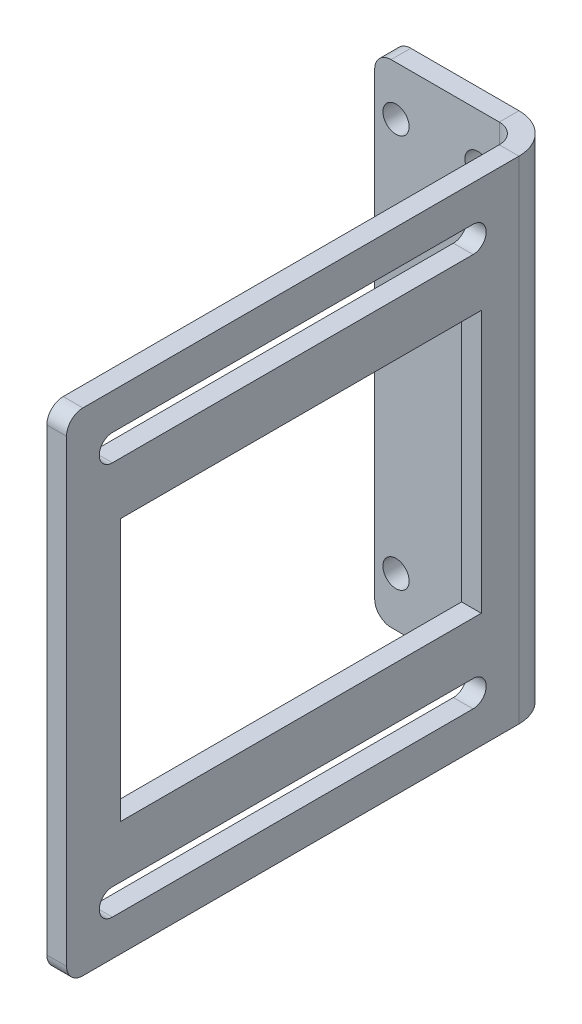
from build123d import *

# Parameters (mm, degrees)
SKETCH1_W                    = 50
SKETCH1_H                    = 150
BASE_FLANGE1_DEPTH           = 6
EDGE_FLANGE1_STRIP_W         = 36
EDGE_FLANGE1_STRIP_H         = 6
EDGE_FLANGE1_STRIP_CUT_DEPTH = 150
EDGE_FLANGE1_DEPTH           = 150
SKETCH9_R                    = 4
CUT_EXTRUDE1_DEPTH           = 6
CUT_EXTRUDE2_DEPTH           = 10
FILLET1_R                    = 5
SKETCH11_W                   = 20
SKETCH11_H                   = 80
SKETCH11_W_2                 = 70
SKETCH11_R                   = 4
SKETCH11_R_2                 = 20
CUT_EXTRUDE5_DEPTH           = 10


# Sheet-metal steps are written as plain solids
with BuildPart() as part:
    # Sketch1 → Base-Flange1 (new body)
    with BuildSketch(Plane.XY):
        with Locations((25, 75)):
            Rectangle(SKETCH1_W, SKETCH1_H)
    extrude(amount=-BASE_FLANGE1_DEPTH)

    # Edge-Flange1 strip (across the edge) → Edge-Flange1 strip cut (cut)
    with BuildSketch(Plane(origin=(50, 0, 0), x_dir=(-1, 0, 0), z_dir=(0, 1, 0))):
        with Locations((-6, -3)):
            Rectangle(EDGE_FLANGE1_STRIP_W, EDGE_FLANGE1_STRIP_H)
    extrude(amount=EDGE_FLANGE1_STRIP_CUT_DEPTH, mode=Mode.SUBTRACT)

    # Edge-Flange1 section (across the edge) → Edge-Flange1 (add)
    with BuildSketch(Plane(origin=(50, 0, 0), x_dir=(-1, 0, 0), z_dir=(0, 1, 0))):
        with BuildLine():
            Line((0, 6), (0, 144))
            Line((0, 144), (6, 144))
            Line((6, 144), (6, 6))
            ThreePointArc((6, 6), (7.757359313, 1.757359313), (12, 0))
            Line((12, 0), (12, -6))
            ThreePointArc((12, -6), (3.514718626, -2.485281374), (0, 6))
        make_face()
    extrude(amount=EDGE_FLANGE1_DEPTH)

    # Sketch9 → Cut-Extrude1 (cut)
    with BuildSketch(Plane.XY):
        with Locations((6.5, 135)):
            Circle(SKETCH9_R)
        with Locations((31.5, 135)):
            Circle(SKETCH9_R)
        with Locations((6.5, 15)):
            Circle(SKETCH9_R)
        with Locations((31.5, 15)):
            Circle(SKETCH9_R)
    extrude(amount=-CUT_EXTRUDE1_DEPTH, mode=Mode.SUBTRACT)

    # Sketch10 → Cut-Extrude2 (cut)
    with BuildSketch(Plane(origin=(50, 0, 0), x_dir=(0, 0, -1), z_dir=(1, 0, 0))):
        with BuildLine():
            Line((-130, 139), (-20, 139))
            ThreePointArc((-20, 139), (-16, 135), (-20, 131))
            Line((-20, 131), (-130, 131))
            ThreePointArc((-130, 131), (-134, 135), (-130, 139))
        make_face()
        with BuildLine():
            Line((-130, 11), (-20, 11))
            ThreePointArc((-20, 11), (-16, 15), (-20, 19))
            Line((-20, 19), (-130, 19))
            ThreePointArc((-130, 19), (-134, 15), (-130, 11))
        make_face()
    extrude(amount=-CUT_EXTRUDE2_DEPTH, mode=Mode.SUBTRACT)

    # Fillet1
    fillet1_edges = [part.edges().sort_by_distance(p)[0] for p in [
        (47, 0, 144),
        (47, 150, 144),
        (0, 0, -3),
        (0, 150, -3),
    ]]
    fillet(fillet1_edges, radius=FILLET1_R)

    # Sketch11 → Cut-Extrude5 (cut)
    # profile 1 of 6: a face of its own
    with BuildSketch(Plane(origin=(50, 0, 0), x_dir=(0, 0, -1), z_dir=(1, 0, 0))):
        with Locations((-117.5, 75)):
            Rectangle(SKETCH11_W, SKETCH11_H)
    # profile 2 of 6: a face of its own
    with BuildSketch(Plane(origin=(50, 0, 0), x_dir=(0, 0, -1), z_dir=(1, 0, 0))):
        with Locations((-27.5, 75)):
            Rectangle(SKETCH11_W, SKETCH11_H)
    # profile 3 of 6: a face of its own
    with BuildSketch(Plane(origin=(50, 0, 0), x_dir=(0, 0, -1), z_dir=(1, 0, 0))):
        with Locations((-72.5, 75)):
            Rectangle(SKETCH11_W_2, SKETCH11_H)
        with Locations((-97.5, 50)):
            Circle(SKETCH11_R, mode=Mode.SUBTRACT)
        with Locations((-47.5, 50)):
            Circle(SKETCH11_R, mode=Mode.SUBTRACT)
        with Locations((-72.5, 75)):
            Circle(SKETCH11_R_2, mode=Mode.SUBTRACT)
        with Locations((-97.5, 100)):
            Circle(SKETCH11_R, mode=Mode.SUBTRACT)
        with Locations((-47.5, 100)):
            Circle(SKETCH11_R, mode=Mode.SUBTRACT)
    # profile 4 of 6: a face of its own
    with BuildSketch(Plane(origin=(50, 0, 0), x_dir=(0, 0, -1), z_dir=(1, 0, 0))):
        with Locations((-72.5, 75)):
            Circle(SKETCH11_R_2)
    # profile 5 of 6: a face of its own
    with BuildSketch(Plane(origin=(50, 0, 0), x_dir=(0, 0, -1), z_dir=(1, 0, 0))):
        with Locations((-47.5, 50)):
            Circle(SKETCH11_R)
    # profile 6 of 6: a face of its own
    with BuildSketch(Plane(origin=(50, 0, 0), x_dir=(0, 0, -1), z_dir=(1, 0, 0))):
        with Locations((-47.5, 100)):
            Circle(SKETCH11_R)
    extrude(amount=-CUT_EXTRUDE5_DEPTH, mode=Mode.SUBTRACT)


with BuildPart() as cut_extrude5_kept_piece:
    # of the separate pieces the step leaves, the one the design keeps (cut_extrude5_pieces_kept)
    add(part.part.solids().sort_by_distance((0, 5, 0))[0])


solid = cut_extrude5_kept_piece.part
